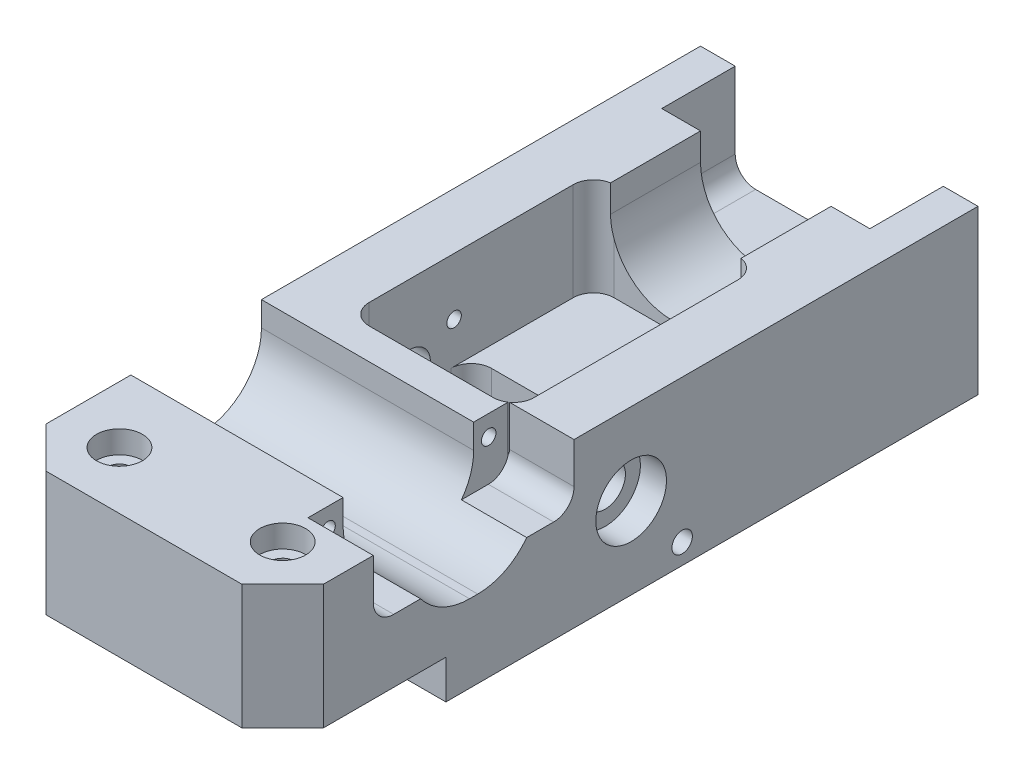
from build123d import *

# Parameters (mm, degrees)
BASE_DEPTH                    = 12.7
BASE_DEPTH_BACK               = 12.7
SKETCH1_W                     = 43.18
SKETCH1_H                     = 108.204
ACTUATORPLANECUT_DEPTH        = 6.0325
CENTERSLOT_DEPTH              = 60.619162222
CENTERSLOT_DEPTH_BACK         = 60.619162222
SKETCH5_W                     = 25.654
SKETCH5_H                     = 19.05
SHAFTGUIDE_REACH              = 113.065
SKETCH2_R                     = 4.7625
CENTERSLOTFILLET_R            = 3.175
GEARBOXPIT_DEPTH              = 11.176
FRONTCUTAWAY_DEPTH            = 15.24
GEARBOXSLOTSH_DEPTH           = 2.286
SKETCH55_R                    = 1.5875
GUIDEBARHOLE_DEPTH            = 71.376336961
PITCHSHAFTHOLE_DEPTH          = 60.619162279
PITCHSHAFTHOLE_DEPTH_BACK     = 60.619162279
SKETCH56_R                    = 3.175
SKETCH57_R                    = 5.5
BEARINGBORER_DEPTH            = 4.064
TOGGLEASSEMHOLES_D            = 2.7051
TOGGLEASSEMHOLES_DEPTH        = 9.398
TOGGLEASSEMHOLES_TIP          = 0.81269403
BACKCHAMFERS_SIZE             = 6.35
PITCHMOTORSLOT_DEPTH          = 71.37633704
PITCHMOTORMOUNTINGSLOTS_DEPTH = 10.16
PITCHMOTORMOUNTINGHOLES_D     = 2.2606
PITCHMOTORMOUNTINGHOLES_DEPTH = 7.5946
PITCHMOTORMOUNTINGHOLES_TIP   = 0.679152758
GEARBOXMOUNTINGHOLES_D        = 2.7051
GEARBOXMOUNTINGHOLES_DEPTH    = 9.398
GEARBOXMOUNTINGHOLES_TIP      = 0.81269403
CAPMOUNTINGHOLES_D            = 3.6576
CAPMOUNTINGHOLES_CBORE_D      = 7.14502
CAPMOUNTINGHOLES_CBORE_DEPTH  = 3.5052
ENCODERMOUNTINGHOLES_D        = 2.2606
ENCODERMOUNTINGHOLES_DEPTH    = 10.1346
ENCODERMOUNTINGHOLES_TIP      = 0.679152758
ROLLMOTORSLOT_REACH           = 113.065
ROLLMOTORMOUNTINGSLOTS_DEPTH  = 11.43
ROLLMOTORMOUNTINGHOLES_D      = 2.2606
ROLLMOTORMOUNTINGHOLES_DEPTH  = 7.62
ROLLMOTORMOUNTINGHOLES_TIP    = 0.679152758


with BuildPart() as part:
    # Sketch1 → Base (new, two sides: drawn at the far end of the back side and taken through both)
    with BuildSketch(Plane(origin=(0, 0, 0), x_dir=(1, 0, 0), z_dir=(0, 1, 0)).offset(-BASE_DEPTH_BACK)):
        Rectangle(SKETCH1_W, SKETCH1_H)
    extrude(amount=BASE_DEPTH + BASE_DEPTH_BACK)

    # Sketch3 → ActuatorPlaneCut (cut)
    with BuildSketch(Plane(origin=(0, -12.7, 0), x_dir=(-1, 0, 0), z_dir=(0, -1, 0))):
        Polygon((10.922, -28.702), (16.256, -28.702), (21.59, -28.702), (21.59, -54.102), (-21.59, -54.102), (-21.59, -28.702), (-10.922, -28.702), (-10.922, -11.176), (10.922, -11.176), align=None)
    extrude(amount=-ACTUATORPLANECUT_DEPTH, mode=Mode.SUBTRACT)

    # Sketch5 → CenterSlot (cut, two sides: drawn at the far end of the back side and taken through both)
    with BuildSketch(Plane(origin=(0, 0, 0), x_dir=(1, 0, 0), z_dir=(0, 1, 0)).offset(-CENTERSLOT_DEPTH_BACK)):
        with Locations((0, 0.127)):
            Rectangle(SKETCH5_W, SKETCH5_H)
    extrude(amount=CENTERSLOT_DEPTH + CENTERSLOT_DEPTH_BACK, mode=Mode.SUBTRACT)

    # Sketch2 → ShaftGuide (cut, up to next)
    with BuildSketch(Plane(origin=(0, 0, -54.102), x_dir=(-1, 0, 0), z_dir=(0, 0, -1)), mode=Mode.PRIVATE) as shaftguide_sk1:
        with Locations((0, -12.7)):
            Circle(SKETCH2_R)
    shaftguide_tool1 = extrude(shaftguide_sk1.sketch, amount=-SHAFTGUIDE_REACH, mode=Mode.PRIVATE) & part.part
    add(shaftguide_tool1.solids().sort_by_distance((0, -12.7, -54.102))[0], mode=Mode.SUBTRACT)

    # CenterSlotFillet
    centerslotfillet_edges = [part.edges().sort_by_distance(p)[0] for p in [
        (-12.827, 0, -9.652),
        (-12.827, 0, 9.398),
        (12.827, 0, 9.398),
        (12.827, 0, -9.652),
    ]]
    fillet(centerslotfillet_edges, radius=CENTERSLOTFILLET_R)

    # Sketch40 → GearBoxPit (cut)
    with BuildSketch(Plane.XZ.offset(12.7)):
        with BuildLine():
            Line((10.922, 6.858), (-10.922, 6.858))
            Line((-10.922, 6.858), (-10.922, 25.527))
            ThreePointArc((-10.922, 25.527), (-9.99206403, 27.77206403), (-7.747, 28.702))
            Line((-7.747, 28.702), (7.747, 28.702))
            ThreePointArc((7.747, 28.702), (9.99206403, 27.77206403), (10.922, 25.527))
            Line((10.922, 25.527), (10.922, 6.858))
        make_face()
    extrude(amount=-GEARBOXPIT_DEPTH, mode=Mode.SUBTRACT)

    # Sketch60 → FrontCutaway (cut)
    with BuildSketch(Plane(origin=(0, 12.7, 0), x_dir=(1, 0, 0), z_dir=(0, 1, 0))):
        with BuildLine():
            Line((-12.827, 6.477), (12.827, 6.477))
            Line((12.827, 6.477), (12.827, 25.527))
            ThreePointArc((12.827, 25.527), (11.89706403, 27.77206403), (9.652, 28.702))
            Line((9.652, 28.702), (-9.652, 28.702))
            ThreePointArc((-9.652, 28.702), (-11.89706403, 27.77206403), (-12.827, 25.527))
            Line((-12.827, 25.527), (-12.827, 6.477))
        make_face()
    extrude(amount=-FRONTCUTAWAY_DEPTH, mode=Mode.SUBTRACT)

    # Sketch67 → GearBoxSlotsH (cut)
    with BuildSketch(Plane(origin=(0, -12.7, 0), x_dir=(-1, 0, 0), z_dir=(0, -1, 0))):
        with BuildLine():
            Line((-12.3825, -12.811125), (12.3825, -12.811125))
            ThreePointArc((12.3825, -12.811125), (12.779375, -13.208), (12.3825, -13.604875))
            Line((12.3825, -13.604875), (-12.3825, -13.604875))
            ThreePointArc((-12.3825, -13.604875), (-12.779375, -13.208), (-12.3825, -12.811125))
        make_face()
        with BuildLine():
            Line((-12.3825, -23.479125), (12.3825, -23.479125))
            ThreePointArc((12.3825, -23.479125), (12.779375, -23.876), (12.3825, -24.272875))
            Line((12.3825, -24.272875), (-12.3825, -24.272875))
            ThreePointArc((-12.3825, -24.272875), (-12.779375, -23.876), (-12.3825, -23.479125))
        make_face()
    extrude(amount=-GEARBOXSLOTSH_DEPTH, mode=Mode.SUBTRACT)

    # Sketch55 → GuideBarHole (cut, through all)
    with BuildSketch(Plane.ZY.offset(21.59)):
        with Locations((-8.0645, -9.525)):
            Circle(SKETCH55_R)
    extrude(amount=-GUIDEBARHOLE_DEPTH, mode=Mode.SUBTRACT)

    # Sketch56 → PitchShaftHole (cut, two sides: drawn at the far end of the back side and taken through both)
    with BuildSketch(Plane(origin=(0, 0, 0), x_dir=(0, 0, -1), z_dir=(1, 0, 0)).offset(-PITCHSHAFTHOLE_DEPTH_BACK)):
        with Locations((0.127, 0)):
            Circle(SKETCH56_R)
    extrude(amount=PITCHSHAFTHOLE_DEPTH + PITCHSHAFTHOLE_DEPTH_BACK, mode=Mode.SUBTRACT)

    # Sketch57 → BearingBoreR (cut)
    with BuildSketch(Plane.ZY.offset(21.59)):
        with Locations((-0.127, 0)):
            Circle(SKETCH57_R)
    bearingborer = extrude(amount=-BEARINGBORER_DEPTH, mode=Mode.SUBTRACT)

    # BearingBoreL: BearingBoreR across plane
    add(bearingborer.mirror(Plane(origin=(0, 0, 0), x_dir=(0, 0, 1), z_dir=(1, 0, 0))), mode=Mode.SUBTRACT)

    # ToggleAssemHoles
    with Locations(Plane(origin=(0, -12.7, 0), x_dir=(-1, 0, 0), z_dir=(0, -1, 0))):
        with Locations((15.875, 22.352), (-15.875, 22.352)):
            Hole(TOGGLEASSEMHOLES_D / 2, depth=TOGGLEASSEMHOLES_DEPTH)
            with Locations((0, 0, -(TOGGLEASSEMHOLES_DEPTH + TOGGLEASSEMHOLES_TIP / 2))):  # 118° drill point
                Cone(0, TOGGLEASSEMHOLES_D / 2, TOGGLEASSEMHOLES_TIP, mode=Mode.SUBTRACT)

    # BackChamfers
    backchamfers_edges = [part.edges().sort_by_distance(p)[0] for p in [
        (21.59, 3.01625, 54.102),
        (-21.59, 3.01625, 54.102),
    ]]
    chamfer(backchamfers_edges, length=BACKCHAMFERS_SIZE)

    # Sketch62 → PitchMotorSlot (cut, through all)
    with BuildSketch(Plane.ZY.offset(21.59)):
        with BuildLine():
            Line((14.224, 9.525), (14.224, 12.7))
            Line((14.224, 12.7), (34.544, 12.7))
            Line((34.544, 12.7), (34.544, 9.525))
            Line((34.544, 9.525), (34.544, 8.89))
            ThreePointArc((34.544, 8.89), (31.754192091, 2.154807909), (25.019, -0.635))
            Line((25.019, -0.635), (23.749, -0.635))
            ThreePointArc((23.749, -0.635), (17.013807909, 2.154807909), (14.224, 8.89))
            Line((14.224, 8.89), (14.224, 9.525))
        make_face()
    extrude(amount=-PITCHMOTORSLOT_DEPTH, mode=Mode.SUBTRACT)

    # Sketch63 → PitchMotorMountingSlots (cut)
    with BuildSketch(Plane.ZY.offset(-21.59)):
        with BuildLine():
            Line((8.763, 12.7), (40.005, 12.7))
            Line((40.005, 12.7), (40.005, 6.35))
            ThreePointArc((40.005, 6.35), (39.07506403, 4.10493597), (36.83, 3.175))
            Line((36.83, 3.175), (11.938, 3.175))
            ThreePointArc((11.938, 3.175), (9.69293597, 4.10493597), (8.763, 6.35))
            Line((8.763, 6.35), (8.763, 12.7))
        make_face()
    extrude(amount=PITCHMOTORMOUNTINGSLOTS_DEPTH, mode=Mode.SUBTRACT)

    # PitchMotorMountingHoles
    with Locations(Plane(origin=(11.43, 0, 0), x_dir=(0, 0, -1), z_dir=(1, 0, 0))):
        with Locations((-36.884, 9.525), (-11.884, 9.525)):
            Hole(PITCHMOTORMOUNTINGHOLES_D / 2, depth=PITCHMOTORMOUNTINGHOLES_DEPTH)
            with Locations((0, 0, -(PITCHMOTORMOUNTINGHOLES_DEPTH + PITCHMOTORMOUNTINGHOLES_TIP / 2))):  # 118° drill point
                Cone(0, PITCHMOTORMOUNTINGHOLES_D / 2, PITCHMOTORMOUNTINGHOLES_TIP, mode=Mode.SUBTRACT)

    # GearBoxMountingHoles
    with Locations(Plane(origin=(0, -12.7, 0), x_dir=(-1, 0, 0), z_dir=(0, -1, 0))):
        with Locations((-16.256, -18.542), (16.256, -18.542)):
            Hole(GEARBOXMOUNTINGHOLES_D / 2, depth=GEARBOXMOUNTINGHOLES_DEPTH)
            with Locations((0, 0, -(GEARBOXMOUNTINGHOLES_DEPTH + GEARBOXMOUNTINGHOLES_TIP / 2))):  # 118° drill point
                Cone(0, GEARBOXMOUNTINGHOLES_D / 2, GEARBOXMOUNTINGHOLES_TIP, mode=Mode.SUBTRACT)

    # CapMountingHoles (through all)
    with Locations(Plane(origin=(-0.837932951, 12.7, 8.633720573), x_dir=(-1, 0, 0), z_dir=(0, 1, 0))):
        with Locations((-13.537932951, 36.578279427), (11.862067049, 36.578279427)):
            CounterBoreHole(CAPMOUNTINGHOLES_D / 2, CAPMOUNTINGHOLES_CBORE_D / 2, CAPMOUNTINGHOLES_CBORE_DEPTH)

    # EncoderMountingHoles
    with Locations(Plane.ZY.offset(21.59)):
        with Locations((6.731, 3.81), (-6.985, 3.81)):
            Hole(ENCODERMOUNTINGHOLES_D / 2, depth=ENCODERMOUNTINGHOLES_DEPTH)
            with Locations((0, 0, -(ENCODERMOUNTINGHOLES_DEPTH + ENCODERMOUNTINGHOLES_TIP / 2))):  # 118° drill point
                Cone(0, ENCODERMOUNTINGHOLES_D / 2, ENCODERMOUNTINGHOLES_TIP, mode=Mode.SUBTRACT)

    # Sketch81 → RollMotorSlot (cut, up to next)
    with BuildSketch(Plane(origin=(0, 0, -54.102), x_dir=(-1, 0, 0), z_dir=(0, 0, -1)), mode=Mode.PRIVATE) as rollmotorslot_sk1:
        with BuildLine():
            Line((10.16, 12.7), (-10.16, 12.7))
            Line((-10.16, 12.7), (-10.16, 8.46582))
            ThreePointArc((-10.16, 8.46582), (-7.370192091, 1.730627909), (-0.635, -1.05918))
            Line((-0.635, -1.05918), (0.635, -1.05918))
            ThreePointArc((0.635, -1.05918), (7.370192091, 1.730627909), (10.16, 8.46582))
            Line((10.16, 8.46582), (10.16, 12.7))
        make_face()
    rollmotorslot_tool1 = extrude(rollmotorslot_sk1.sketch, amount=-ROLLMOTORSLOT_REACH, mode=Mode.PRIVATE) & part.part
    add(rollmotorslot_tool1.solids().sort_by_distance((0, 6.589347, -54.102))[0], mode=Mode.SUBTRACT)

    # Sketch84 → RollMotorMountingSlots (cut)
    with BuildSketch(Plane(origin=(0, 0, -54.102), x_dir=(-1, 0, 0), z_dir=(0, 0, -1))):
        with BuildLine():
            Line((16.1925, 12.7), (-16.1925, 12.7))
            Line((-16.1925, 12.7), (-16.1925, 0.84582))
            ThreePointArc((-16.1925, 0.84582), (-15.26256403, -1.39924403), (-13.0175, -2.32918))
            Line((-13.0175, -2.32918), (13.0175, -2.32918))
            ThreePointArc((13.0175, -2.32918), (15.26256403, -1.39924403), (16.1925, 0.84582))
            Line((16.1925, 0.84582), (16.1925, 12.7))
        make_face()
    extrude(amount=-ROLLMOTORMOUNTINGSLOTS_DEPTH, mode=Mode.SUBTRACT)

    # RollMotorMountingHoles
    with Locations(Plane(origin=(0, 0, -42.672), x_dir=(-1, 0, 0), z_dir=(0, 0, -1))):
        with Locations((12.5, 8.46582), (-12.5, 8.46582)):
            Hole(ROLLMOTORMOUNTINGHOLES_D / 2, depth=ROLLMOTORMOUNTINGHOLES_DEPTH)
            with Locations((0, 0, -(ROLLMOTORMOUNTINGHOLES_DEPTH + ROLLMOTORMOUNTINGHOLES_TIP / 2))):  # 118° drill point
                Cone(0, ROLLMOTORMOUNTINGHOLES_D / 2, ROLLMOTORMOUNTINGHOLES_TIP, mode=Mode.SUBTRACT)


solid = part.part
